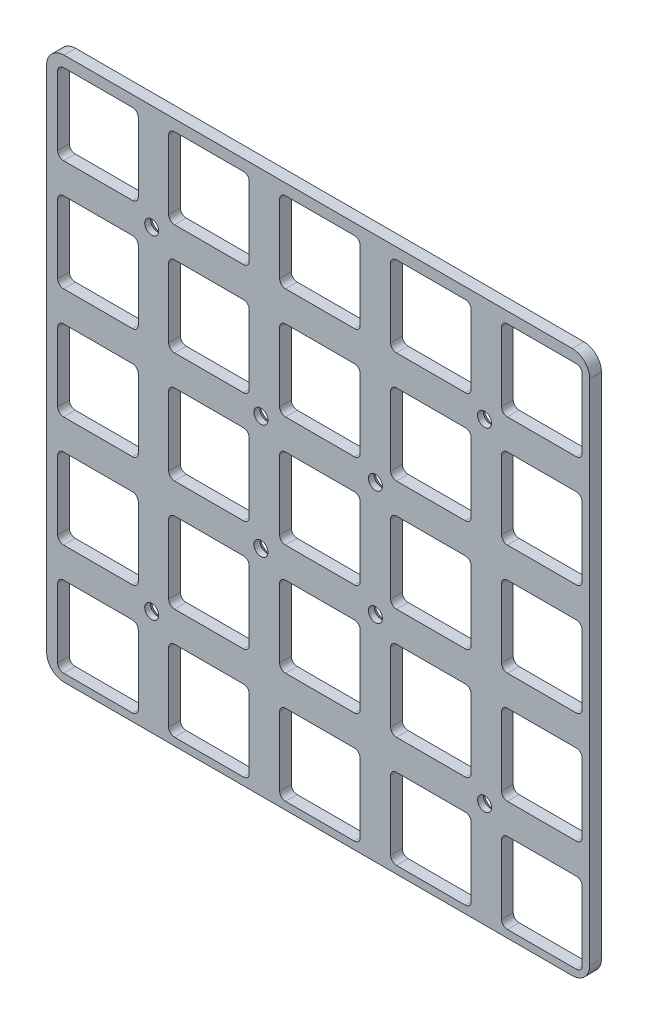
from build123d import *

# Parameters (mm, degrees)
BOSS_EXTRUDE1_DEPTH                            = 2
CSK_FOR_M2_FLAT_HEAD_MACHINE_SCREW5_AT_2_COUNT = 2
CSK_FOR_M2_FLAT_HEAD_MACHINE_SCREW5_AT_2_PITCH = 42.621356149
CSK_FOR_M2_FLAT_HEAD_MACHINE_SCREW5_AT_3_COUNT = 2
CSK_FOR_M2_FLAT_HEAD_MACHINE_SCREW5_AT_3_PITCH = 19.6
CSK_FOR_M2_FLAT_HEAD_MACHINE_SCREW5_AT_4_COUNT = 2
CSK_FOR_M2_FLAT_HEAD_MACHINE_SCREW5_AT_4_PITCH = 54.164379439
CSK_FOR_M2_FLAT_HEAD_MACHINE_SCREW5_AT_5_COUNT = 2
CSK_FOR_M2_FLAT_HEAD_MACHINE_SCREW5_AT_5_PITCH = 27.718585823
CSK_FOR_M2_FLAT_HEAD_MACHINE_SCREW5_AT_6_COUNT = 2
CSK_FOR_M2_FLAT_HEAD_MACHINE_SCREW5_AT_6_PITCH = 42.621356149
CSK_FOR_M2_FLAT_HEAD_MACHINE_SCREW5_AT_7_COUNT = 2
CSK_FOR_M2_FLAT_HEAD_MACHINE_SCREW5_AT_7_PITCH = 19.6
CSK_FOR_M2_FLAT_HEAD_MACHINE_SCREW5_AT_8_COUNT = 2
CSK_FOR_M2_FLAT_HEAD_MACHINE_SCREW5_AT_8_PITCH = 26.445793616


with BuildPart() as part:
    # Sketch2 → Boss-Extrude1 (new body)
    with BuildSketch(Plane.XY):
        with BuildLine():
            Line((-43.5, 46.5), (43.5, 46.5))
            ThreePointArc((43.5, 46.5), (45.621320344, 45.621320344), (46.5, 43.5))
            Line((46.5, 43.5), (46.5, -43.5))
            ThreePointArc((46.5, -43.5), (45.621320344, -45.621320344), (43.5, -46.5))
            Line((43.5, -46.5), (-43.5, -46.5))
            ThreePointArc((-43.5, -46.5), (-45.621320344, -45.621320344), (-46.5, -43.5))
            Line((-46.5, -43.5), (-46.5, 43.5))
            ThreePointArc((-46.5, 43.5), (-45.621320344, 45.621320344), (-43.5, 46.5))
        make_face()
        with BuildLine():
            Line((-25.6, 43.6), (-25.6, 31.8))
            ThreePointArc((-25.6, 31.8), (-25.307106781, 31.092893219), (-24.6, 30.8))
            Line((-24.6, 30.8), (-12.8, 30.8))
            ThreePointArc((-12.8, 30.8), (-12.092893219, 31.092893219), (-11.8, 31.8))
            Line((-11.8, 31.8), (-11.8, 43.6))
            ThreePointArc((-11.8, 43.6), (-12.092893219, 44.307106781), (-12.8, 44.6))
            Line((-12.8, 44.6), (-24.6, 44.6))
            ThreePointArc((-24.6, 44.6), (-25.307106781, 44.307106781), (-25.6, 43.6))
        make_face(mode=Mode.SUBTRACT)
        with BuildLine():
            Line((-43.6, 44.6), (-31.8, 44.6))
            ThreePointArc((-31.8, 44.6), (-31.092893219, 44.307106781), (-30.8, 43.6))
            Line((-30.8, 43.6), (-30.8, 31.8))
            ThreePointArc((-30.8, 31.8), (-31.092893219, 31.092893219), (-31.8, 30.8))
            Line((-31.8, 30.8), (-43.6, 30.8))
            ThreePointArc((-43.6, 30.8), (-44.307106781, 31.092893219), (-44.6, 31.8))
            Line((-44.6, 31.8), (-44.6, 43.6))
            ThreePointArc((-44.6, 43.6), (-44.307106781, 44.307106781), (-43.6, 44.6))
        make_face(mode=Mode.SUBTRACT)
        with BuildLine():
            Line((-6.6, 43.6), (-6.6, 31.8))
            ThreePointArc((-6.6, 31.8), (-6.307106781, 31.092893219), (-5.6, 30.8))
            Line((-5.6, 30.8), (6.2, 30.8))
            ThreePointArc((6.2, 30.8), (6.907106781, 31.092893219), (7.2, 31.8))
            Line((7.2, 31.8), (7.2, 43.6))
            ThreePointArc((7.2, 43.6), (6.907106781, 44.307106781), (6.2, 44.6))
            Line((6.2, 44.6), (-5.6, 44.6))
            ThreePointArc((-5.6, 44.6), (-6.307106781, 44.307106781), (-6.6, 43.6))
        make_face(mode=Mode.SUBTRACT)
        with BuildLine():
            Line((12.4, 43.6), (12.4, 31.8))
            ThreePointArc((12.4, 31.8), (12.692893219, 31.092893219), (13.4, 30.8))
            Line((13.4, 30.8), (25.2, 30.8))
            ThreePointArc((25.2, 30.8), (25.907106781, 31.092893219), (26.2, 31.8))
            Line((26.2, 31.8), (26.2, 43.6))
            ThreePointArc((26.2, 43.6), (25.907106781, 44.307106781), (25.2, 44.6))
            Line((25.2, 44.6), (13.4, 44.6))
            ThreePointArc((13.4, 44.6), (12.692893219, 44.307106781), (12.4, 43.6))
        make_face(mode=Mode.SUBTRACT)
        with BuildLine():
            Line((31.4, 43.6), (31.4, 31.8))
            ThreePointArc((31.4, 31.8), (31.692893219, 31.092893219), (32.4, 30.8))
            Line((32.4, 30.8), (44.2, 30.8))
            ThreePointArc((44.2, 30.8), (44.907106781, 31.092893219), (45.2, 31.8))
            Line((45.2, 31.8), (45.2, 43.6))
            ThreePointArc((45.2, 43.6), (44.907106781, 44.307106781), (44.2, 44.6))
            Line((44.2, 44.6), (32.4, 44.6))
            ThreePointArc((32.4, 44.6), (31.692893219, 44.307106781), (31.4, 43.6))
        make_face(mode=Mode.SUBTRACT)
        with BuildLine():
            Line((-25.6, 24.6), (-25.6, 12.8))
            ThreePointArc((-25.6, 12.8), (-25.307106781, 12.092893219), (-24.6, 11.8))
            Line((-24.6, 11.8), (-12.8, 11.8))
            ThreePointArc((-12.8, 11.8), (-12.092893219, 12.092893219), (-11.8, 12.8))
            Line((-11.8, 12.8), (-11.8, 24.6))
            ThreePointArc((-11.8, 24.6), (-12.092893219, 25.307106781), (-12.8, 25.6))
            Line((-12.8, 25.6), (-24.6, 25.6))
            ThreePointArc((-24.6, 25.6), (-25.307106781, 25.307106781), (-25.6, 24.6))
        make_face(mode=Mode.SUBTRACT)
        with BuildLine():
            Line((-6.6, 24.6), (-6.6, 12.8))
            ThreePointArc((-6.6, 12.8), (-6.307106781, 12.092893219), (-5.6, 11.8))
            Line((-5.6, 11.8), (6.2, 11.8))
            ThreePointArc((6.2, 11.8), (6.907106781, 12.092893219), (7.2, 12.8))
            Line((7.2, 12.8), (7.2, 24.6))
            ThreePointArc((7.2, 24.6), (6.907106781, 25.307106781), (6.2, 25.6))
            Line((6.2, 25.6), (-5.6, 25.6))
            ThreePointArc((-5.6, 25.6), (-6.307106781, 25.307106781), (-6.6, 24.6))
        make_face(mode=Mode.SUBTRACT)
        with BuildLine():
            Line((12.4, 24.6), (12.4, 12.8))
            ThreePointArc((12.4, 12.8), (12.692893219, 12.092893219), (13.4, 11.8))
            Line((13.4, 11.8), (25.2, 11.8))
            ThreePointArc((25.2, 11.8), (25.907106781, 12.092893219), (26.2, 12.8))
            Line((26.2, 12.8), (26.2, 24.6))
            ThreePointArc((26.2, 24.6), (25.907106781, 25.307106781), (25.2, 25.6))
            Line((25.2, 25.6), (13.4, 25.6))
            ThreePointArc((13.4, 25.6), (12.692893219, 25.307106781), (12.4, 24.6))
        make_face(mode=Mode.SUBTRACT)
        with BuildLine():
            Line((31.4, 24.6), (31.4, 12.8))
            ThreePointArc((31.4, 12.8), (31.692893219, 12.092893219), (32.4, 11.8))
            Line((32.4, 11.8), (44.2, 11.8))
            ThreePointArc((44.2, 11.8), (44.907106781, 12.092893219), (45.2, 12.8))
            Line((45.2, 12.8), (45.2, 24.6))
            ThreePointArc((45.2, 24.6), (44.907106781, 25.307106781), (44.2, 25.6))
            Line((44.2, 25.6), (32.4, 25.6))
            ThreePointArc((32.4, 25.6), (31.692893219, 25.307106781), (31.4, 24.6))
        make_face(mode=Mode.SUBTRACT)
        with BuildLine():
            Line((-25.6, 5.6), (-25.6, -6.2))
            ThreePointArc((-25.6, -6.2), (-25.307106781, -6.907106781), (-24.6, -7.2))
            Line((-24.6, -7.2), (-12.8, -7.2))
            ThreePointArc((-12.8, -7.2), (-12.092893219, -6.907106781), (-11.8, -6.2))
            Line((-11.8, -6.2), (-11.8, 5.6))
            ThreePointArc((-11.8, 5.6), (-12.092893219, 6.307106781), (-12.8, 6.6))
            Line((-12.8, 6.6), (-24.6, 6.6))
            ThreePointArc((-24.6, 6.6), (-25.307106781, 6.307106781), (-25.6, 5.6))
        make_face(mode=Mode.SUBTRACT)
        with BuildLine():
            Line((-6.6, 5.6), (-6.6, -6.2))
            ThreePointArc((-6.6, -6.2), (-6.307106781, -6.907106781), (-5.6, -7.2))
            Line((-5.6, -7.2), (6.2, -7.2))
            ThreePointArc((6.2, -7.2), (6.907106781, -6.907106781), (7.2, -6.2))
            Line((7.2, -6.2), (7.2, 5.6))
            ThreePointArc((7.2, 5.6), (6.907106781, 6.307106781), (6.2, 6.6))
            Line((6.2, 6.6), (-5.6, 6.6))
            ThreePointArc((-5.6, 6.6), (-6.307106781, 6.307106781), (-6.6, 5.6))
        make_face(mode=Mode.SUBTRACT)
        with BuildLine():
            Line((12.4, 5.6), (12.4, -6.2))
            ThreePointArc((12.4, -6.2), (12.692893219, -6.907106781), (13.4, -7.2))
            Line((13.4, -7.2), (25.2, -7.2))
            ThreePointArc((25.2, -7.2), (25.907106781, -6.907106781), (26.2, -6.2))
            Line((26.2, -6.2), (26.2, 5.6))
            ThreePointArc((26.2, 5.6), (25.907106781, 6.307106781), (25.2, 6.6))
            Line((25.2, 6.6), (13.4, 6.6))
            ThreePointArc((13.4, 6.6), (12.692893219, 6.307106781), (12.4, 5.6))
        make_face(mode=Mode.SUBTRACT)
        with BuildLine():
            Line((31.4, 5.6), (31.4, -6.2))
            ThreePointArc((31.4, -6.2), (31.692893219, -6.907106781), (32.4, -7.2))
            Line((32.4, -7.2), (44.2, -7.2))
            ThreePointArc((44.2, -7.2), (44.907106781, -6.907106781), (45.2, -6.2))
            Line((45.2, -6.2), (45.2, 5.6))
            ThreePointArc((45.2, 5.6), (44.907106781, 6.307106781), (44.2, 6.6))
            Line((44.2, 6.6), (32.4, 6.6))
            ThreePointArc((32.4, 6.6), (31.692893219, 6.307106781), (31.4, 5.6))
        make_face(mode=Mode.SUBTRACT)
        with BuildLine():
            Line((-25.6, -13.4), (-25.6, -25.2))
            ThreePointArc((-25.6, -25.2), (-25.307106781, -25.907106781), (-24.6, -26.2))
            Line((-24.6, -26.2), (-12.8, -26.2))
            ThreePointArc((-12.8, -26.2), (-12.092893219, -25.907106781), (-11.8, -25.2))
            Line((-11.8, -25.2), (-11.8, -13.4))
            ThreePointArc((-11.8, -13.4), (-12.092893219, -12.692893219), (-12.8, -12.4))
            Line((-12.8, -12.4), (-24.6, -12.4))
            ThreePointArc((-24.6, -12.4), (-25.307106781, -12.692893219), (-25.6, -13.4))
        make_face(mode=Mode.SUBTRACT)
        with BuildLine():
            Line((-6.6, -13.4), (-6.6, -25.2))
            ThreePointArc((-6.6, -25.2), (-6.307106781, -25.907106781), (-5.6, -26.2))
            Line((-5.6, -26.2), (6.2, -26.2))
            ThreePointArc((6.2, -26.2), (6.907106781, -25.907106781), (7.2, -25.2))
            Line((7.2, -25.2), (7.2, -13.4))
            ThreePointArc((7.2, -13.4), (6.907106781, -12.692893219), (6.2, -12.4))
            Line((6.2, -12.4), (-5.6, -12.4))
            ThreePointArc((-5.6, -12.4), (-6.307106781, -12.692893219), (-6.6, -13.4))
        make_face(mode=Mode.SUBTRACT)
        with BuildLine():
            Line((12.4, -13.4), (12.4, -25.2))
            ThreePointArc((12.4, -25.2), (12.692893219, -25.907106781), (13.4, -26.2))
            Line((13.4, -26.2), (25.2, -26.2))
            ThreePointArc((25.2, -26.2), (25.907106781, -25.907106781), (26.2, -25.2))
            Line((26.2, -25.2), (26.2, -13.4))
            ThreePointArc((26.2, -13.4), (25.907106781, -12.692893219), (25.2, -12.4))
            Line((25.2, -12.4), (13.4, -12.4))
            ThreePointArc((13.4, -12.4), (12.692893219, -12.692893219), (12.4, -13.4))
        make_face(mode=Mode.SUBTRACT)
        with BuildLine():
            Line((31.4, -13.4), (31.4, -25.2))
            ThreePointArc((31.4, -25.2), (31.692893219, -25.907106781), (32.4, -26.2))
            Line((32.4, -26.2), (44.2, -26.2))
            ThreePointArc((44.2, -26.2), (44.907106781, -25.907106781), (45.2, -25.2))
            Line((45.2, -25.2), (45.2, -13.4))
            ThreePointArc((45.2, -13.4), (44.907106781, -12.692893219), (44.2, -12.4))
            Line((44.2, -12.4), (32.4, -12.4))
            ThreePointArc((32.4, -12.4), (31.692893219, -12.692893219), (31.4, -13.4))
        make_face(mode=Mode.SUBTRACT)
        with BuildLine():
            Line((-25.6, -32.4), (-25.6, -44.2))
            ThreePointArc((-25.6, -44.2), (-25.307106781, -44.907106781), (-24.6, -45.2))
            Line((-24.6, -45.2), (-12.8, -45.2))
            ThreePointArc((-12.8, -45.2), (-12.092893219, -44.907106781), (-11.8, -44.2))
            Line((-11.8, -44.2), (-11.8, -32.4))
            ThreePointArc((-11.8, -32.4), (-12.092893219, -31.692893219), (-12.8, -31.4))
            Line((-12.8, -31.4), (-24.6, -31.4))
            ThreePointArc((-24.6, -31.4), (-25.307106781, -31.692893219), (-25.6, -32.4))
        make_face(mode=Mode.SUBTRACT)
        with BuildLine():
            Line((-6.6, -32.4), (-6.6, -44.2))
            ThreePointArc((-6.6, -44.2), (-6.307106781, -44.907106781), (-5.6, -45.2))
            Line((-5.6, -45.2), (6.2, -45.2))
            ThreePointArc((6.2, -45.2), (6.907106781, -44.907106781), (7.2, -44.2))
            Line((7.2, -44.2), (7.2, -32.4))
            ThreePointArc((7.2, -32.4), (6.907106781, -31.692893219), (6.2, -31.4))
            Line((6.2, -31.4), (-5.6, -31.4))
            ThreePointArc((-5.6, -31.4), (-6.307106781, -31.692893219), (-6.6, -32.4))
        make_face(mode=Mode.SUBTRACT)
        with BuildLine():
            Line((12.4, -32.4), (12.4, -44.2))
            ThreePointArc((12.4, -44.2), (12.692893219, -44.907106781), (13.4, -45.2))
            Line((13.4, -45.2), (25.2, -45.2))
            ThreePointArc((25.2, -45.2), (25.907106781, -44.907106781), (26.2, -44.2))
            Line((26.2, -44.2), (26.2, -32.4))
            ThreePointArc((26.2, -32.4), (25.907106781, -31.692893219), (25.2, -31.4))
            Line((25.2, -31.4), (13.4, -31.4))
            ThreePointArc((13.4, -31.4), (12.692893219, -31.692893219), (12.4, -32.4))
        make_face(mode=Mode.SUBTRACT)
        with BuildLine():
            Line((31.4, -32.4), (31.4, -44.2))
            ThreePointArc((31.4, -44.2), (31.692893219, -44.907106781), (32.4, -45.2))
            Line((32.4, -45.2), (44.2, -45.2))
            ThreePointArc((44.2, -45.2), (44.907106781, -44.907106781), (45.2, -44.2))
            Line((45.2, -44.2), (45.2, -32.4))
            ThreePointArc((45.2, -32.4), (44.907106781, -31.692893219), (44.2, -31.4))
            Line((44.2, -31.4), (32.4, -31.4))
            ThreePointArc((32.4, -31.4), (31.692893219, -31.692893219), (31.4, -32.4))
        make_face(mode=Mode.SUBTRACT)
        with BuildLine():
            Line((-44.6, 24.6), (-44.6, 12.8))
            ThreePointArc((-44.6, 12.8), (-44.307106781, 12.092893219), (-43.6, 11.8))
            Line((-43.6, 11.8), (-31.8, 11.8))
            ThreePointArc((-31.8, 11.8), (-31.092893219, 12.092893219), (-30.8, 12.8))
            Line((-30.8, 12.8), (-30.8, 24.6))
            ThreePointArc((-30.8, 24.6), (-31.092893219, 25.307106781), (-31.8, 25.6))
            Line((-31.8, 25.6), (-43.6, 25.6))
            ThreePointArc((-43.6, 25.6), (-44.307106781, 25.307106781), (-44.6, 24.6))
        make_face(mode=Mode.SUBTRACT)
        with BuildLine():
            Line((-44.6, 5.6), (-44.6, -6.2))
            ThreePointArc((-44.6, -6.2), (-44.307106781, -6.907106781), (-43.6, -7.2))
            Line((-43.6, -7.2), (-31.8, -7.2))
            ThreePointArc((-31.8, -7.2), (-31.092893219, -6.907106781), (-30.8, -6.2))
            Line((-30.8, -6.2), (-30.8, 5.6))
            ThreePointArc((-30.8, 5.6), (-31.092893219, 6.307106781), (-31.8, 6.6))
            Line((-31.8, 6.6), (-43.6, 6.6))
            ThreePointArc((-43.6, 6.6), (-44.307106781, 6.307106781), (-44.6, 5.6))
        make_face(mode=Mode.SUBTRACT)
        with BuildLine():
            Line((-44.6, -13.4), (-44.6, -25.2))
            ThreePointArc((-44.6, -25.2), (-44.307106781, -25.907106781), (-43.6, -26.2))
            Line((-43.6, -26.2), (-31.8, -26.2))
            ThreePointArc((-31.8, -26.2), (-31.092893219, -25.907106781), (-30.8, -25.2))
            Line((-30.8, -25.2), (-30.8, -13.4))
            ThreePointArc((-30.8, -13.4), (-31.092893219, -12.692893219), (-31.8, -12.4))
            Line((-31.8, -12.4), (-43.6, -12.4))
            ThreePointArc((-43.6, -12.4), (-44.307106781, -12.692893219), (-44.6, -13.4))
        make_face(mode=Mode.SUBTRACT)
        with BuildLine():
            Line((-44.6, -32.4), (-44.6, -44.2))
            ThreePointArc((-44.6, -44.2), (-44.307106781, -44.907106781), (-43.6, -45.2))
            Line((-43.6, -45.2), (-31.8, -45.2))
            ThreePointArc((-31.8, -45.2), (-31.092893219, -44.907106781), (-30.8, -44.2))
            Line((-30.8, -44.2), (-30.8, -32.4))
            ThreePointArc((-30.8, -32.4), (-31.092893219, -31.692893219), (-31.8, -31.4))
            Line((-31.8, -31.4), (-43.6, -31.4))
            ThreePointArc((-43.6, -31.4), (-44.307106781, -31.692893219), (-44.6, -32.4))
        make_face(mode=Mode.SUBTRACT)
    extrude(amount=BOSS_EXTRUDE1_DEPTH)

    # Sketch7 → CSK for M2 Flat Head Machine Screw5 (revolve, cut)
    with BuildSketch(Plane(origin=(-9.8, -9.8, 0), x_dir=(0, 1, 0), z_dir=(1, 0, 0))):
        Polygon((0, 0), (0, 2), (1.2, 2), (1.2, 1), (2.2, 0), align=None)
    csk_for_m2_flat_head_machine_screw5 = revolve(axis=Axis((-9.8, -9.8, -6.35), (0, 0, 1)), mode=Mode.SUBTRACT)

    # CSK for M2 Flat Head Machine Screw5 at 2: CSK for M2 Flat Head Machine Screw5 ×2
    with Locations(*[Vector(0.8986105431721928, -0.43874718426421466, 0) * (i * CSK_FOR_M2_FLAT_HEAD_MACHINE_SCREW5_AT_2_PITCH) for i in range(1, CSK_FOR_M2_FLAT_HEAD_MACHINE_SCREW5_AT_2_COUNT)]):
        add(csk_for_m2_flat_head_machine_screw5, mode=Mode.SUBTRACT)

    # CSK for M2 Flat Head Machine Screw5 at 3: CSK for M2 Flat Head Machine Screw5 ×2
    with Locations(*[(i * CSK_FOR_M2_FLAT_HEAD_MACHINE_SCREW5_AT_3_PITCH, 0, 0) for i in range(1, CSK_FOR_M2_FLAT_HEAD_MACHINE_SCREW5_AT_3_COUNT)]):
        add(csk_for_m2_flat_head_machine_screw5, mode=Mode.SUBTRACT)

    # CSK for M2 Flat Head Machine Screw5 at 4: CSK for M2 Flat Head Machine Screw5 ×2
    with Locations(*[Vector(0.7071067811865456, 0.7071067811865496, 0) * (i * CSK_FOR_M2_FLAT_HEAD_MACHINE_SCREW5_AT_4_PITCH) for i in range(1, CSK_FOR_M2_FLAT_HEAD_MACHINE_SCREW5_AT_4_COUNT)]):
        add(csk_for_m2_flat_head_machine_screw5, mode=Mode.SUBTRACT)

    # CSK for M2 Flat Head Machine Screw5 at 5: CSK for M2 Flat Head Machine Screw5 ×2
    with Locations(*[Vector(0.7071067811865427, 0.7071067811865523, 0) * (i * CSK_FOR_M2_FLAT_HEAD_MACHINE_SCREW5_AT_5_PITCH) for i in range(1, CSK_FOR_M2_FLAT_HEAD_MACHINE_SCREW5_AT_5_COUNT)]):
        add(csk_for_m2_flat_head_machine_screw5, mode=Mode.SUBTRACT)

    # CSK for M2 Flat Head Machine Screw5 at 6: CSK for M2 Flat Head Machine Screw5 ×2
    with Locations(*[Vector(-0.43874718426421694, 0.8986105431721917, 0) * (i * CSK_FOR_M2_FLAT_HEAD_MACHINE_SCREW5_AT_6_PITCH) for i in range(1, CSK_FOR_M2_FLAT_HEAD_MACHINE_SCREW5_AT_6_COUNT)]):
        add(csk_for_m2_flat_head_machine_screw5, mode=Mode.SUBTRACT)

    # CSK for M2 Flat Head Machine Screw5 at 7: CSK for M2 Flat Head Machine Screw5 ×2
    with Locations(*[(0, i * CSK_FOR_M2_FLAT_HEAD_MACHINE_SCREW5_AT_7_PITCH, 0) for i in range(1, CSK_FOR_M2_FLAT_HEAD_MACHINE_SCREW5_AT_7_COUNT)]):
        add(csk_for_m2_flat_head_machine_screw5, mode=Mode.SUBTRACT)

    # CSK for M2 Flat Head Machine Screw5 at 8: CSK for M2 Flat Head Machine Screw5 ×2
    with Locations(*[Vector(-0.7071067811865511, -0.7071067811865439, 0) * (i * CSK_FOR_M2_FLAT_HEAD_MACHINE_SCREW5_AT_8_PITCH) for i in range(1, CSK_FOR_M2_FLAT_HEAD_MACHINE_SCREW5_AT_8_COUNT)]):
        add(csk_for_m2_flat_head_machine_screw5, mode=Mode.SUBTRACT)


solid = part.part
